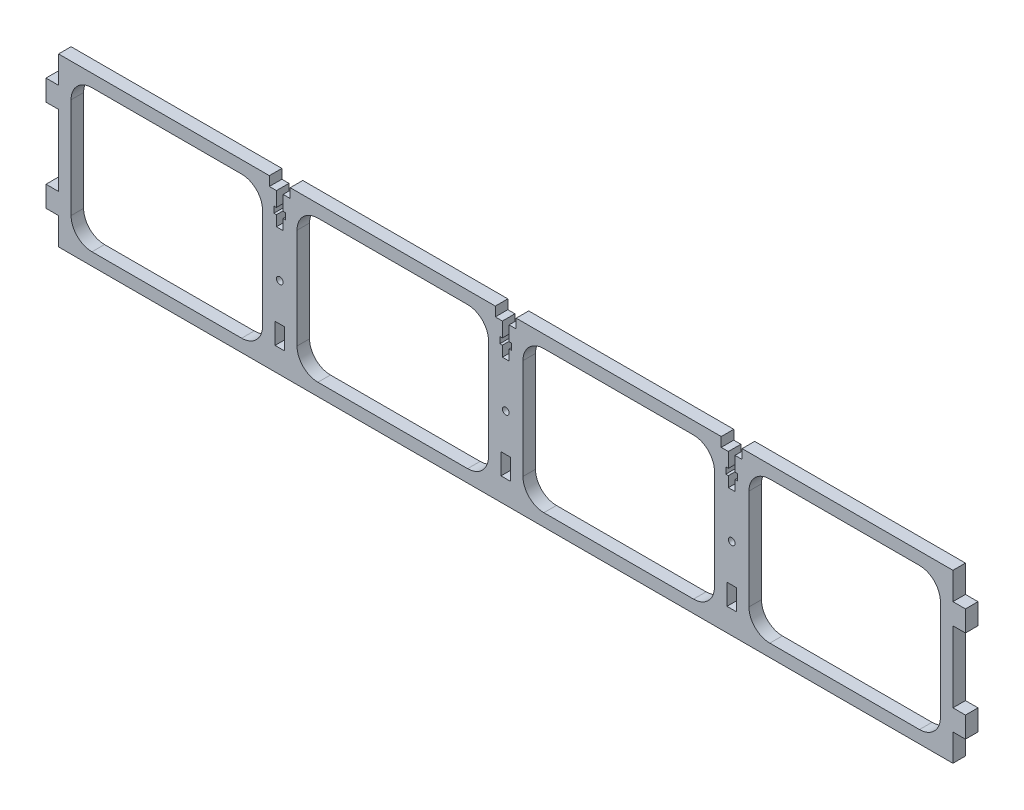
from build123d import *

# Parameters (mm, degrees)
SKETCH1_W           = 428
SKETCH1_H           = 80
BOSS_EXTRUDE1_DEPTH = 6
CUT_EXTRUDE1_REACH  = 219.789
LPATTERN1_COUNT     = 4
LPATTERN1_PITCH     = 108.125
SKETCH3_R           = 1.6
SKETCH3_W           = 4.5
SKETCH3_H           = 10
CUT_EXTRUDE2_DEPTH  = 218.788888605
SKETCH4_W           = 6
SKETCH4_H           = 10
BOSS_EXTRUDE2_DEPTH = 6
SKETCH5_W           = 10
SKETCH5_H           = 6
CUT_EXTRUDE3_DEPTH  = 4.5
CUT_EXTRUDE4_REACH  = 225.687


with BuildPart() as part:
    # Sketch1 → Boss-Extrude1 (new body)
    with BuildSketch(Plane.XY):
        Rectangle(SKETCH1_W, SKETCH1_H)
    extrude(amount=BOSS_EXTRUDE1_DEPTH)

    # Sketch2 → Cut-Extrude1 (cut, up to next)
    with BuildSketch(Plane.XY.offset(6), mode=Mode.PRIVATE) as cut_extrude1_sk1:
        with BuildLine():
            ThreePointArc((-126.375, -34), (-119.303932188, -31.071067812), (-116.375, -24))
            Line((-116.375, -24), (-116.375, 24))
            ThreePointArc((-116.375, 24), (-119.303932188, 31.071067812), (-126.375, 34))
            Line((-126.375, 34), (-198, 34))
            ThreePointArc((-198, 34), (-205.071067812, 31.071067812), (-208, 24))
            Line((-208, 24), (-208, -24))
            ThreePointArc((-208, -24), (-205.071067812, -31.071067812), (-198, -34))
            Line((-198, -34), (-126.375, -34))
        make_face()
    cut_extrude1_tool1 = extrude(cut_extrude1_sk1.sketch, amount=-CUT_EXTRUDE1_REACH, mode=Mode.PRIVATE) & part.part
    cut_extrude1 = cut_extrude1_tool1.solids().sort_by_distance((-162.1875, 0, 6))[0]
    add(cut_extrude1, mode=Mode.SUBTRACT)

    # LPattern1: Cut-Extrude1 ×4
    with Locations(*[(i * LPATTERN1_PITCH, 0, 0) for i in range(1, LPATTERN1_COUNT)]):
        add(cut_extrude1, mode=Mode.SUBTRACT)

    # Sketch3 → Cut-Extrude2 (cut, through all)
    with BuildSketch(Plane(origin=(0, 0, 0), x_dir=(-1, 0, 0), z_dir=(0, 0, -1))):
        with Locations((108.125, -1)):
            Circle(SKETCH3_R)
        with Locations((0, -1)):
            Circle(SKETCH3_R)
        with Locations((-108.125, -1)):
            Circle(SKETCH3_R)
        with Locations((-108.125, -24)):
            Rectangle(SKETCH3_W, SKETCH3_H)
        with Locations((0, -24)):
            Rectangle(SKETCH3_W, SKETCH3_H)
        with Locations((108.125, -24)):
            Rectangle(SKETCH3_W, SKETCH3_H)
    extrude(amount=-CUT_EXTRUDE2_DEPTH, mode=Mode.SUBTRACT)

    # Sketch4 → Boss-Extrude2 (add)
    with BuildSketch(Plane(origin=(0, 0, 0), x_dir=(-1, 0, 0), z_dir=(0, 0, -1))):
        with Locations((-217, 22)):
            Rectangle(SKETCH4_W, SKETCH4_H)
        with Locations((-217, -22)):
            Rectangle(SKETCH4_W, SKETCH4_H)
        with Locations((217, -22)):
            Rectangle(SKETCH4_W, SKETCH4_H)
        with Locations((217, 22)):
            Rectangle(SKETCH4_W, SKETCH4_H)
    extrude(amount=-BOSS_EXTRUDE2_DEPTH)

    # Sketch5 → Cut-Extrude3 (cut)
    with BuildSketch(Plane(origin=(0, 40, 0), x_dir=(1, 0, 0), z_dir=(0, 1, 0))):
        with Locations((-108.125, -3)):
            Rectangle(SKETCH5_W, SKETCH5_H)
        with Locations((0, -3)):
            Rectangle(SKETCH5_W, SKETCH5_H)
        with Locations((108.125, -3)):
            Rectangle(SKETCH5_W, SKETCH5_H)
    extrude(amount=-CUT_EXTRUDE3_DEPTH, mode=Mode.SUBTRACT)

    # Sketch6 → Cut-Extrude4 (cut, up to next)
    with BuildSketch(Plane(origin=(0, 0, 0), x_dir=(-1, 0, 0), z_dir=(0, 0, -1)), mode=Mode.PRIVATE) as cut_extrude4_sk1:
        Polygon((-109.725, 35.5), (-109.725, 28.5), (-110.925, 28.5), (-110.925, 25.5), (-109.725, 25.5), (-109.725, 20.5), (-106.525, 20.5), (-106.525, 25.5), (-105.325, 25.5), (-105.325, 28.5), (-106.525, 28.5), (-106.525, 35.5), align=None)
    cut_extrude4_tool1 = extrude(cut_extrude4_sk1.sketch, amount=-CUT_EXTRUDE4_REACH, mode=Mode.PRIVATE) & part.part
    # Sketch6 → Cut-Extrude4 (cut, up to next)
    with BuildSketch(Plane(origin=(0, 0, 0), x_dir=(-1, 0, 0), z_dir=(0, 0, -1)), mode=Mode.PRIVATE) as cut_extrude4_sk2:
        Polygon((-1.595, 28.5), (-2.795, 28.5), (-2.795, 25.5), (-1.595, 25.5), (-1.595, 20.5), (1.605, 20.5), (1.605, 25.5), (2.805, 25.5), (2.805, 28.5), (1.605, 28.5), (1.605, 35.5), (-1.595, 35.5), align=None)
    cut_extrude4_tool2 = extrude(cut_extrude4_sk2.sketch, amount=-CUT_EXTRUDE4_REACH, mode=Mode.PRIVATE) & part.part
    # Sketch6 → Cut-Extrude4 (cut, up to next)
    with BuildSketch(Plane(origin=(0, 0, 0), x_dir=(-1, 0, 0), z_dir=(0, 0, -1)), mode=Mode.PRIVATE) as cut_extrude4_sk3:
        Polygon((106.535, 35.5), (106.535, 28.5), (105.335, 28.5), (105.335, 25.5), (106.535, 25.5), (106.535, 20.5), (109.735, 20.5), (109.735, 25.5), (110.935, 25.5), (110.935, 28.5), (109.735, 28.5), (109.735, 35.5), align=None)
    cut_extrude4_tool3 = extrude(cut_extrude4_sk3.sketch, amount=-CUT_EXTRUDE4_REACH, mode=Mode.PRIVATE) & part.part
    add(cut_extrude4_tool1.solids().sort_by_distance((108.125, 27.869565, 0))[0], mode=Mode.SUBTRACT)
    add(cut_extrude4_tool2.solids().sort_by_distance((-0.005, 27.869565, 0))[0], mode=Mode.SUBTRACT)
    add(cut_extrude4_tool3.solids().sort_by_distance((-108.135, 27.869565, 0))[0], mode=Mode.SUBTRACT)


solid = part.part
